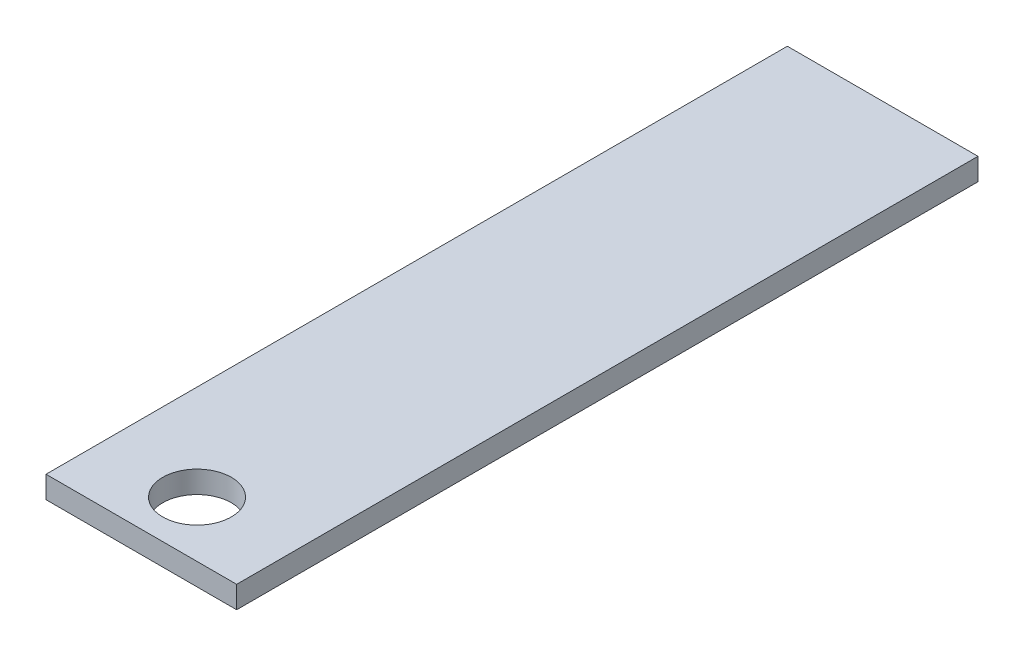
from build123d import *

# Parameters (mm, degrees)
SKETCH3_W           = 61.722
SKETCH3_H           = 7.14375
BOSS_EXTRUDE1_DEPTH = 120
CUT_EXTRUDE1_REACH  = 126.111
SKETCH5_R           = 11.1125


with BuildPart() as part:
    # Sketch3 → Boss-Extrude1 (new, symmetric)
    with BuildSketch(Plane.XY):
        Rectangle(SKETCH3_W, SKETCH3_H)
    extrude(amount=BOSS_EXTRUDE1_DEPTH, both=True)

    # Sketch5 → Cut-Extrude1 (cut, up to next)
    with BuildSketch(Plane.XZ.offset(3.571875), mode=Mode.PRIVATE) as cut_extrude1_sk1:
        with Locations((0, 101.966)):
            Circle(SKETCH5_R)
    cut_extrude1_tool1 = extrude(cut_extrude1_sk1.sketch, amount=-CUT_EXTRUDE1_REACH, mode=Mode.PRIVATE) & part.part
    add(cut_extrude1_tool1.solids().sort_by_distance((0, -3.571875, 101.966))[0], mode=Mode.SUBTRACT)


solid = part.part
